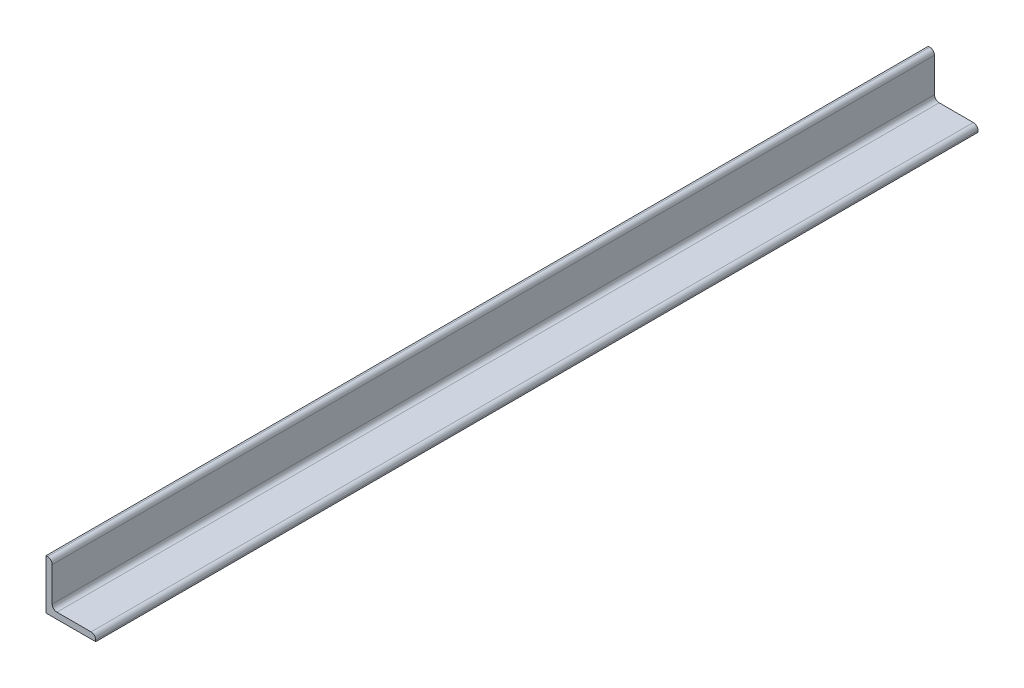
from build123d import *

# Parameters (mm, degrees)
BOSS_EXTRUDE1_DEPTH = 450.85


with BuildPart() as part:
    # Sketch1 → Boss-Extrude1 (new, symmetric)
    with BuildSketch(Plane.XY):
        with BuildLine():
            Line((0, 0), (0, 50.8))
            Line((0, 50.8), (1.59258, 50.8))
            ThreePointArc((1.59258, 50.8), (4.956583943, 49.406583943), (6.35, 46.04258))
            Line((6.35, 46.04258), (6.35, 11.1125))
            ThreePointArc((6.35, 11.1125), (7.744903955, 7.744903955), (11.1125, 6.35))
            Line((11.1125, 6.35), (46.04258, 6.35))
            ThreePointArc((46.04258, 6.35), (49.406583943, 4.956583943), (50.8, 1.59258))
            Line((50.8, 1.59258), (50.8, 0))
            Line((50.8, 0), (0, 0))
        make_face()
    extrude(amount=BOSS_EXTRUDE1_DEPTH, both=True)


solid = part.part
